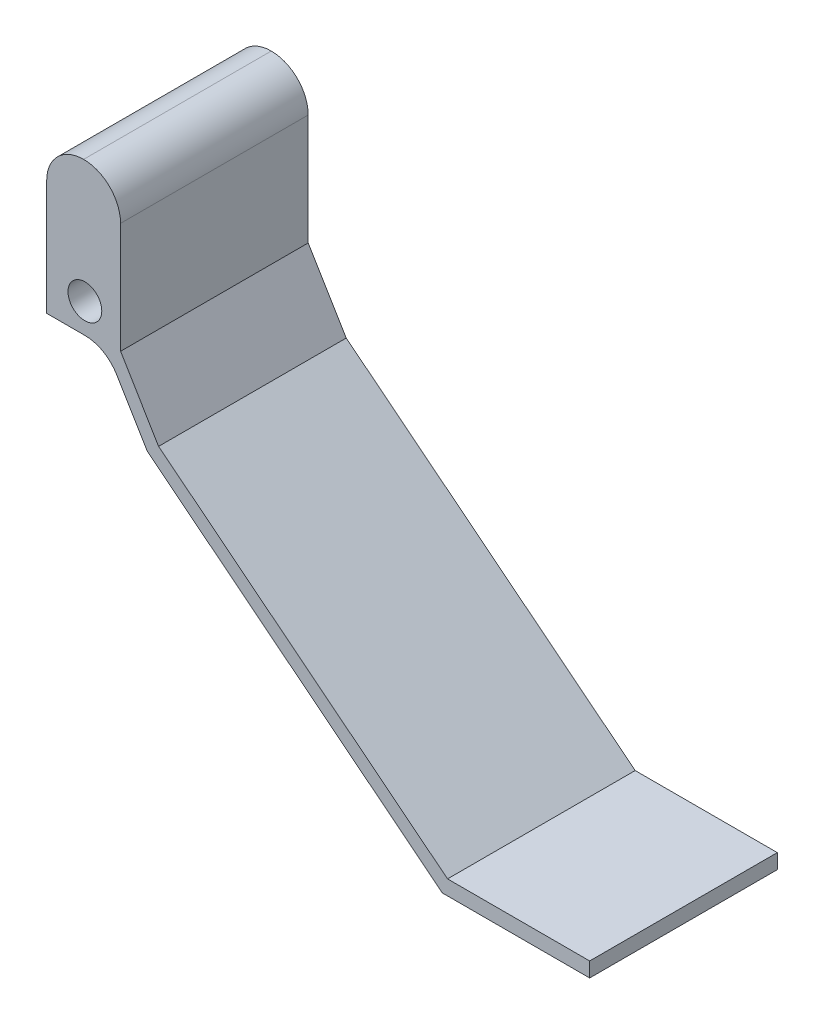
from build123d import *

# Parameters (mm, degrees)
BOSS_EXTRUDE1_DEPTH = 25.4
FILLET1_R           = 5
FILLET2_R           = 5
FILLET3_R           = 5
SKETCH2_R           = 2.286
CUT_EXTRUDE2_DEPTH  = 81.112257119


with BuildPart() as part:
    # Sketch1 → Boss-Extrude1 (new body)
    with BuildSketch(Plane.XY):
        Polygon((0, 0), (5.147680359, -8.573294986), (44.26134523, -39.720064006), (63.5, -39.720064006), (63.5, -41.720064006), (43.562310597, -41.720064006), (3.619073412, -9.912694725), (-2, -0.554309869), (-10, -0.554309869), (-10, 20), (0, 20), align=None)
    extrude(amount=BOSS_EXTRUDE1_DEPTH)

    # Fillet1
    fillet1_edges = [part.edges().sort_by_distance(p)[0] for p in [
        (-2, -0.554309869, 12.7),
    ]]
    fillet(fillet1_edges, radius=FILLET1_R)

    # Fillet2
    fillet2_edges = [part.edges().sort_by_distance(p)[0] for p in [
        (0, 20, 12.7),
    ]]
    fillet(fillet2_edges, radius=FILLET2_R)

    # Fillet3
    fillet3_edges = [part.edges().sort_by_distance(p)[0] for p in [
        (-10, 20, 12.7),
    ]]
    fillet(fillet3_edges, radius=FILLET3_R - 0.0001)  # a hair under: the kernel refuses the full size

    # Sketch2 → Cut-Extrude2 (cut, through all)
    with BuildSketch(Plane.XY.offset(25.4)):
        with Locations((-4.829903584, 3.445690131)):
            Circle(SKETCH2_R)
    extrude(amount=-CUT_EXTRUDE2_DEPTH, mode=Mode.SUBTRACT)


solid = part.part
